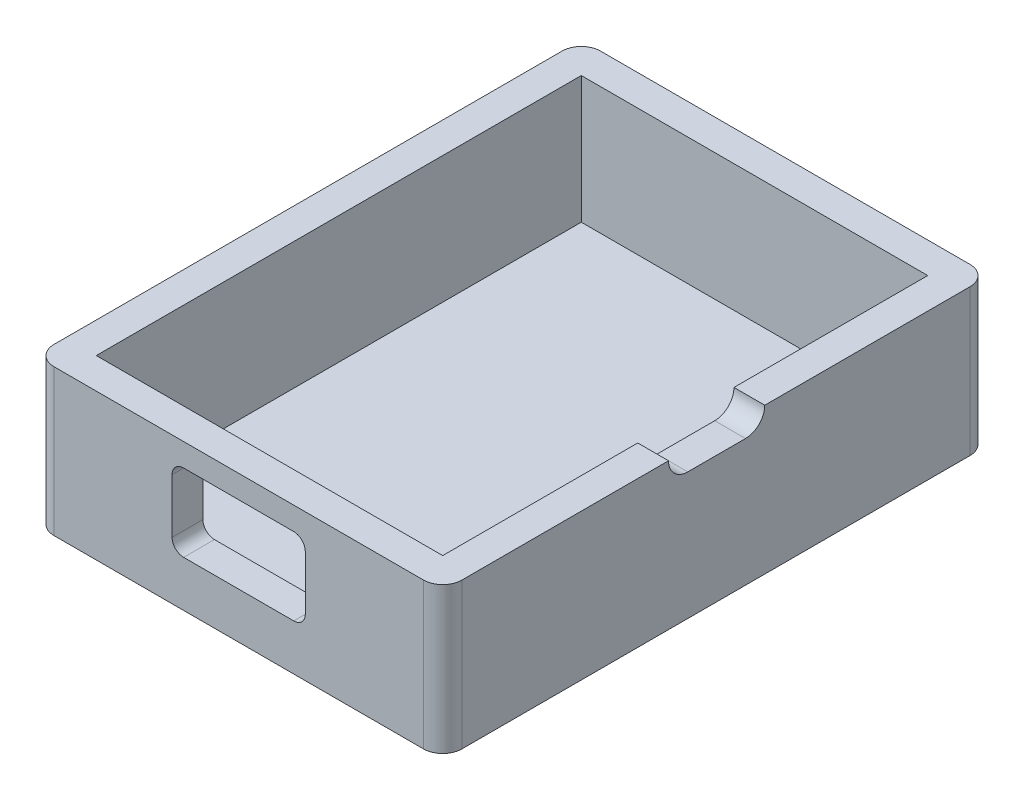
from build123d import *

# Parameters (mm, degrees)
SKETCH1_W           = 106
SKETCH1_H           = 142
BOSS_EXTRUDE1_DEPTH = 5
SKETCH2_W           = 106
SKETCH2_H           = 8
BOSS_EXTRUDE2_DEPTH = 33
SKETCH3_W           = 106
SKETCH3_H           = 8
BOSS_EXTRUDE3_DEPTH = 33
SKETCH4_W           = 8
SKETCH4_H           = 126
BOSS_EXTRUDE4_DEPTH = 33
SKETCH5_W           = 90
SKETCH5_H           = 15
BOSS_EXTRUDE5_DEPTH = 5
SKETCH6_W           = 34.6
SKETCH6_H           = 20.1
CUT_EXTRUDE1_DEPTH  = 10
FILLET1_R           = 3
FILLET2_R           = 5
SKETCH8_W           = 25
SKETCH8_H           = 5
CUT_EXTRUDE2_DEPTH  = 10
FILLET3_R           = 5


with BuildPart() as part:
    # Sketch1 → Boss-Extrude1 (new body)
    with BuildSketch(Plane(origin=(0, 0, 0), x_dir=(1, 0, 0), z_dir=(0, 1, 0))):
        Rectangle(SKETCH1_W, SKETCH1_H)
    extrude(amount=BOSS_EXTRUDE1_DEPTH)

    # Sketch2 → Boss-Extrude2 (add)
    with BuildSketch(Plane(origin=(0, 5, 0), x_dir=(1, 0, 0), z_dir=(0, 1, 0))):
        with Locations((0, -67)):
            Rectangle(SKETCH2_W, SKETCH2_H)
    extrude(amount=BOSS_EXTRUDE2_DEPTH)

    # Sketch3 → Boss-Extrude3 (add)
    with BuildSketch(Plane(origin=(0, 5, 0), x_dir=(1, 0, 0), z_dir=(0, 1, 0))):
        with Locations((0, 67)):
            Rectangle(SKETCH3_W, SKETCH3_H)
    extrude(amount=BOSS_EXTRUDE3_DEPTH)

    # Sketch4 → Boss-Extrude4 (add)
    with BuildSketch(Plane(origin=(0, 5, 0), x_dir=(1, 0, 0), z_dir=(0, 1, 0))):
        with Locations((-49, 0)):
            Rectangle(SKETCH4_W, SKETCH4_H)
        with Locations((49, 0)):
            Rectangle(SKETCH4_W, SKETCH4_H)
    extrude(amount=BOSS_EXTRUDE4_DEPTH)

    # Sketch5 → Boss-Extrude5 (add)
    with BuildSketch(Plane(origin=(0, 5, 0), x_dir=(1, 0, 0), z_dir=(0, 1, 0))):
        with Locations((0, -55.5)):
            Rectangle(SKETCH5_W, SKETCH5_H)
    extrude(amount=BOSS_EXTRUDE5_DEPTH)

    # Sketch6 → Cut-Extrude1 (cut)
    with BuildSketch(Plane.XY.offset(71)):
        with Locations((0, 22)):
            Rectangle(SKETCH6_W, SKETCH6_H)
    extrude(amount=-CUT_EXTRUDE1_DEPTH, mode=Mode.SUBTRACT)

    # Fillet1
    fillet1_edges = [part.edges().sort_by_distance(p)[0] for p in [
        (17.3, 32.05, 67),
        (17.3, 11.95, 67),
        (-17.3, 11.95, 67),
        (-17.3, 32.05, 67),
    ]]
    fillet(fillet1_edges, radius=FILLET1_R)

    # Fillet2
    fillet2_edges = [part.edges().sort_by_distance(p)[0] for p in [
        (53, 19, 71),
        (-53, 19, 71),
        (-53, 19, -71),
        (53, 19, -71),
    ]]
    fillet(fillet2_edges, radius=FILLET2_R)

    # Sketch8 → Cut-Extrude2 (cut)
    with BuildSketch(Plane(origin=(53, 0, 0), x_dir=(0, 0, -1), z_dir=(1, 0, 0))):
        with Locations((0.163227162, 35.5)):
            Rectangle(SKETCH8_W, SKETCH8_H)
    extrude(amount=-CUT_EXTRUDE2_DEPTH, mode=Mode.SUBTRACT)

    # Fillet3
    fillet3_edges = [part.edges().sort_by_distance(p)[0] for p in [
        (49, 33, 12.336772838),
        (49, 33, -12.663227162),
    ]]
    fillet(fillet3_edges, radius=FILLET3_R - 0.0001)  # a hair under: the kernel refuses the full size


solid = part.part
